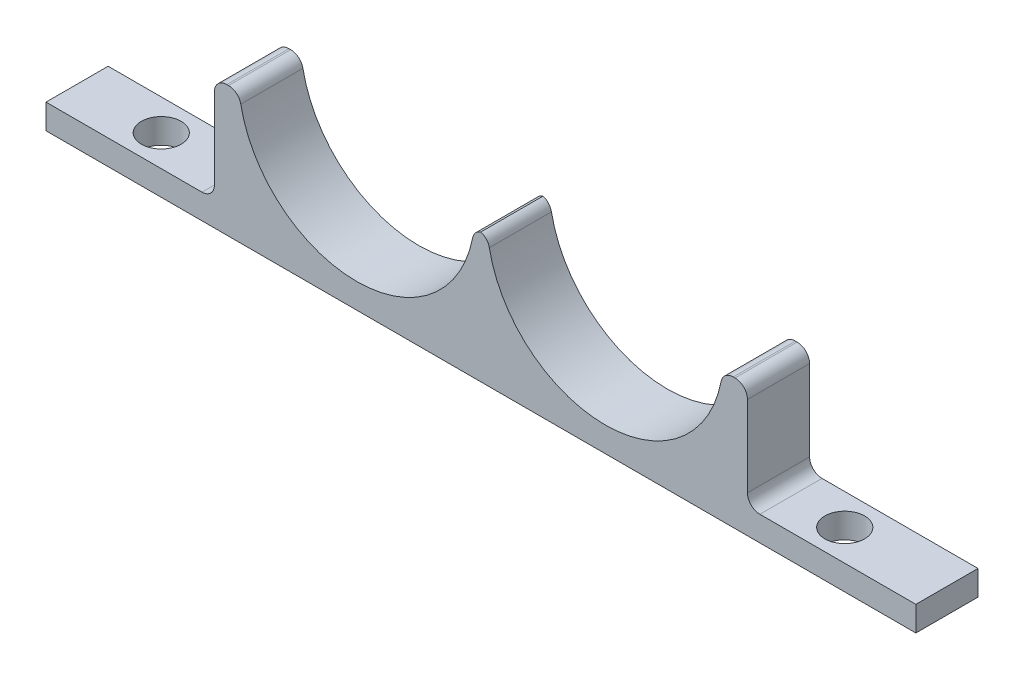
from build123d import *

# Parameters (mm, degrees)
BOSS_EXTRU_1_DEPTH      = 5
ESQUISSE2_R             = 1.6
ENL_V_MAT_EXTRU_1_DEPTH = 71.691230008
CONG_1_R                = 1
CONG_2_R                = 1


with BuildPart() as part:
    # Esquisse1 → Boss.-Extru.1 (new body)
    with BuildSketch(Plane.XY):
        with BuildLine():
            Line((0, 0), (70, 0))
            Line((70, 0), (70, 2))
            Line((70, 2), (56.447221814, 2))
            Line((56.447221814, 2), (56.447221814, 10.5))
            Line((56.447221814, 10.5), (54.447221814, 10.5))
            ThreePointArc((54.447221814, 10.5), (45, 2), (35.552778186, 10.5))
            Line((35.552778186, 10.5), (34.447221814, 10.5))
            ThreePointArc((34.447221814, 10.5), (25, 2), (15.552778186, 10.5))
            Line((15.552778186, 10.5), (13.552778186, 10.5))
            Line((13.552778186, 10.5), (13.552778186, 2))
            Line((13.552778186, 2), (0, 2))
            Line((0, 2), (0, 0))
        make_face()
    extrude(amount=BOSS_EXTRU_1_DEPTH)

    # Esquisse2 → Enlèv. mat.-Extru.1 (cut, through all)
    with BuildSketch(Plane(origin=(0, 2, 0), x_dir=(1, 0, 0), z_dir=(0, 1, 0))):
        with Locations(Location((6.776389093, -2.5, 0), (0, 0, 270))):
            Circle(ESQUISSE2_R)
        with Locations(Location((61.776389093, -2.5, 0), (0, 0, 90))):
            Circle(ESQUISSE2_R)
    extrude(amount=-ENL_V_MAT_EXTRU_1_DEPTH, mode=Mode.SUBTRACT)

    # Congé1
    cong_1_edges = [part.edges().sort_by_distance(p)[0] for p in [
        (13.552778186, 2, 2.5),
    ]]
    fillet(cong_1_edges, radius=CONG_1_R)

    # Congé2
    # the kernel refuses this fillet: 1 mm, written as the material it adds along each edge
    with BuildSketch(Plane(origin=(56.447221814, 2, 0), x_dir=(1, 0, 0), z_dir=(0, 0, 1))) as cong_2_piece_1:
        with BuildLine():
            CenterArc((CONG_2_R, CONG_2_R), CONG_2_R, 180, 90)
            Line((0, CONG_2_R), (0, 0))
            Line((0, 0), (CONG_2_R, 0))
        make_face()
    extrude(amount=5)
    # the kernel refuses this fillet: 1 mm, written as the material it takes off along each edge
    with BuildSketch(Plane(origin=(13.552778186, 10.5, -2.5), x_dir=(0, -1, 0), z_dir=(0, 0, 1)), Plane(origin=(56.447221814, 10.5, -2.5), x_dir=(-1, 0, 0), z_dir=(0, 0, 1))) as cong_2_2_piece_1:
        with BuildLine():
            CenterArc((CONG_2_R, CONG_2_R), CONG_2_R, 180, 90)
            Line((0, CONG_2_R), (0, 0))
            Line((0, 0), (CONG_2_R, 0))
        make_face()
    extrude(amount=10, mode=Mode.SUBTRACT)
    with BuildSketch(Plane(origin=(15.552778186, 10.5, -2.151355625), x_dir=(-1, 0, 0), z_dir=(0, 0, 1)), Plane(origin=(35.552778186, 10.5, -2.151355625), x_dir=(-1, 0, 0), z_dir=(0, 0, 1))) as cong_2_2_piece_2:
        with BuildLine():
            CenterArc((0.86054225, 1), CONG_2_R, 190.980575428, 79.019424572)
            ThreePointArc((-0.121149565, 0.80952381), (-0.05185196, 0.406067322), (0, 0))
            Line((0, 0), (0.86054225, 0))
        make_face()
    extrude(amount=9.302711251, mode=Mode.SUBTRACT)
    with BuildSketch(Plane(origin=(34.447221814, 10.5, -2.151355625), x_dir=(-0.1480070865029111, -0.9889863003828312, 0), z_dir=(0, 0, 1)), Plane(origin=(54.447221814, 10.5, -2.151355625), x_dir=(-0.1480070865029111, -0.9889863003828312, 0), z_dir=(0, 0, 1))) as cong_2_2_piece_3:
        with BuildLine():
            CenterArc((0.861619949, 0.999071583), CONG_2_R, 188.511451923, 79.019424572)
            Line((-0.127366351, 0.851064496), (0, 0))
            ThreePointArc((0, 0), (0.409269476, 0.008819963), (0.818538952, 0))
        make_face()
    extrude(amount=9.302711251, mode=Mode.SUBTRACT)


solid = part.part
